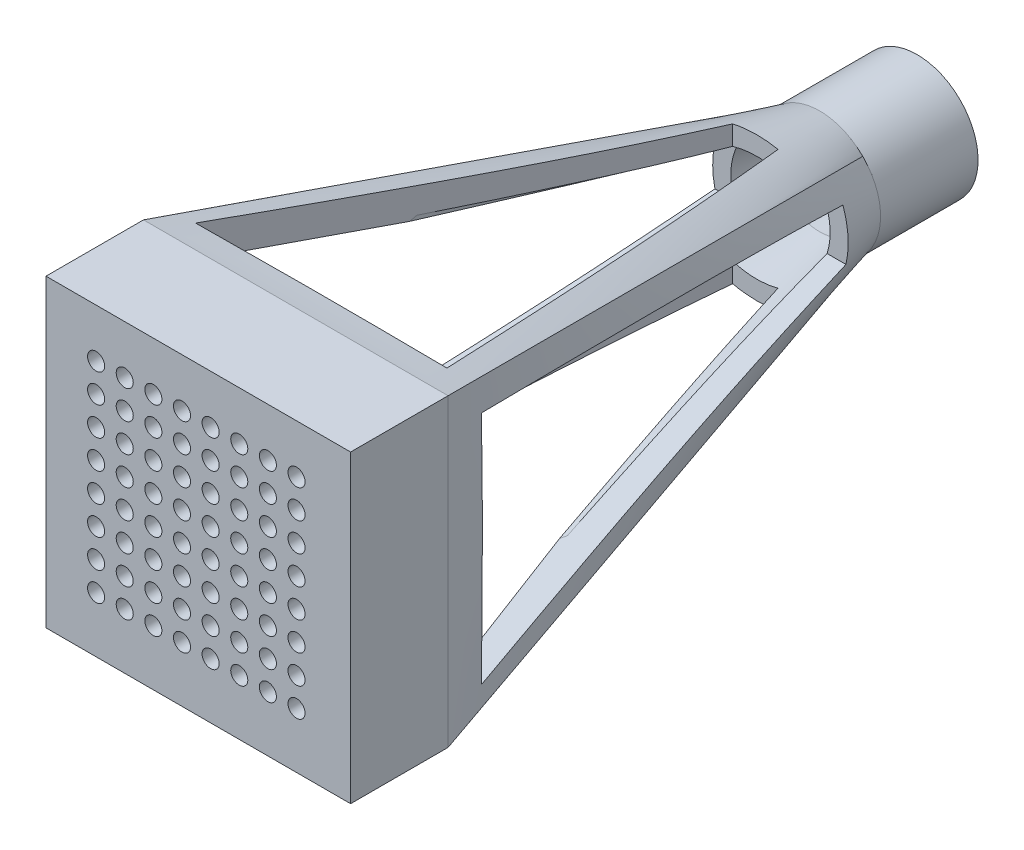
from build123d import *

# Parameters (mm, degrees)
SKETCH4_W           = 25
SKETCH4_H           = 25
BOSS_EXTRUDE1_DEPTH = 8
SKETCH5_R           = 0.7
CUT_EXTRUDE1_DEPTH  = 8
SKETCH6_R           = 5
SKETCH6_R_2         = 3.6
BOSS_EXTRUDE2_DEPTH = 8
CUT_EXTRUDE2_DEPTH  = 58
CUT_EXTRUDE3_DEPTH  = 58
CUT_EXTRUDE4_DEPTH  = 58
CUT_EXTRUDE5_DEPTH  = 58


with BuildPart() as part:
    # Loft1: read off the stored shape, not the designer's step
    # Loft1: loft between two sections, ruled curve by curve
    loft1_from = [
        Edge.make_bspline([(-12.5, 12.5, 43), (-10.416666667, 12.5, 43), (-8.333333333, 12.5, 43), (-5.208333333, 12.5, 43), (-4.166666667, 12.5, 43), (-2.083333333, 12.5, 43), (-1.041666667, 12.5, 43), (1.041666667, 12.5, 43), (2.083333333, 12.5, 43), (4.166666667, 12.5, 43), (5.208333333, 12.5, 43), (8.333333333, 12.5, 43), (10.416666667, 12.5, 43), (12.5, 12.5, 43)], [0, 0, 0, 0, 0.25, 0.25, 0.375, 0.375, 0.5, 0.5, 0.625, 0.625, 0.75, 0.75, 1, 1, 1, 1], 3),
        Edge.make_bspline([(12.5, 12.5, 43), (12.5, 10.416666667, 43), (12.5, 8.333333333, 43), (12.5, 5.208333333, 43), (12.5, 4.166666667, 43), (12.5, 2.083333333, 43), (12.5, 1.041666667, 43), (12.5, -1.041666667, 43), (12.5, -2.083333333, 43), (12.5, -4.166666667, 43), (12.5, -5.208333333, 43), (12.5, -8.333333333, 43), (12.5, -10.416666667, 43), (12.5, -12.5, 43)], [0, 0, 0, 0, 0.25, 0.25, 0.375, 0.375, 0.5, 0.5, 0.625, 0.625, 0.75, 0.75, 1, 1, 1, 1], 3),
        Edge.make_bspline([(-12.5, -12.5, 43), (-12.5, -10.416666667, 43), (-12.5, -8.333333333, 43), (-12.5, -5.208333333, 43), (-12.5, -4.166666667, 43), (-12.5, -2.083333333, 43), (-12.5, -1.041666667, 43), (-12.5, 1.041666667, 43), (-12.5, 2.083333333, 43), (-12.5, 4.166666667, 43), (-12.5, 5.208333333, 43), (-12.5, 8.333333333, 43), (-12.5, 10.416666667, 43), (-12.5, 12.5, 43)], [0, 0, 0, 0, 0.25, 0.25, 0.375, 0.375, 0.5, 0.5, 0.625, 0.625, 0.75, 0.75, 1, 1, 1, 1], 3),
        Edge.make_bspline([(12.5, -12.5, 43), (10.416666667, -12.5, 43), (8.333333333, -12.5, 43), (5.208333333, -12.5, 43), (4.166666667, -12.5, 43), (2.083333333, -12.5, 43), (1.041666667, -12.5, 43), (-1.041666667, -12.5, 43), (-2.083333333, -12.5, 43), (-4.166666667, -12.5, 43), (-5.208333333, -12.5, 43), (-8.333333333, -12.5, 43), (-10.416666667, -12.5, 43), (-12.5, -12.5, 43)], [0, 0, 0, 0, 0.25, 0.25, 0.375, 0.375, 0.5, 0.5, 0.625, 0.625, 0.75, 0.75, 1, 1, 1, 1], 3),
    ]
    loft1_to = [
        Edge.make_bspline([(-3.535533906, 3.535533906, 0), (-3.118867239, 3.952200573, 0), (-2.593397212, 4.325792981, 0), (-1.6821315, 4.720167594, 0), (-1.358816515, 4.823924825, 0), (-0.690278229, 4.963884467, 0), (-0.345177969, 5, 0), (0.345177969, 5, 0), (0.690278229, 4.963884467, 0), (1.358816515, 4.823924825, 0), (1.6821315, 4.720167594, 0), (2.593397212, 4.325792981, 0), (3.118867239, 3.952200573, 0), (3.535533906, 3.535533906, 0)], [0, 0, 0, 0, 0.25, 0.25, 0.375, 0.375, 0.5, 0.5, 0.625, 0.625, 0.75, 0.75, 1, 1, 1, 1], 3),
        Edge.make_bspline([(3.535533906, 3.535533906, 0), (3.952200573, 3.118867239, 0), (4.325792981, 2.593397212, 0), (4.720167594, 1.6821315, 0), (4.823924825, 1.358816515, 0), (4.963884467, 0.690278229, 0), (5, 0.345177969, 0), (5, -0.345177969, 0), (4.963884467, -0.690278229, 0), (4.823924825, -1.358816515, 0), (4.720167594, -1.6821315, 0), (4.325792981, -2.593397212, 0), (3.952200573, -3.118867239, 0), (3.535533906, -3.535533906, 0)], [0, 0, 0, 0, 0.25, 0.25, 0.375, 0.375, 0.5, 0.5, 0.625, 0.625, 0.75, 0.75, 1, 1, 1, 1], 3),
        Edge.make_bspline([(-3.535533906, -3.535533906, 0), (-3.952200573, -3.118867239, 0), (-4.325792981, -2.593397212, 0), (-4.720167594, -1.6821315, 0), (-4.823924825, -1.358816515, 0), (-4.963884467, -0.690278229, 0), (-5, -0.345177969, 0), (-5, 0.345177969, 0), (-4.963884467, 0.690278229, 0), (-4.823924825, 1.358816515, 0), (-4.720167594, 1.6821315, 0), (-4.325792981, 2.593397212, 0), (-3.952200573, 3.118867239, 0), (-3.535533906, 3.535533906, 0)], [0, 0, 0, 0, 0.25, 0.25, 0.375, 0.375, 0.5, 0.5, 0.625, 0.625, 0.75, 0.75, 1, 1, 1, 1], 3),
        Edge.make_bspline([(3.535533906, -3.535533906, 0), (3.118867239, -3.952200573, 0), (2.593397212, -4.325792981, 0), (1.6821315, -4.720167594, 0), (1.358816515, -4.823924825, 0), (0.690278229, -4.963884467, 0), (0.345177969, -5, 0), (-0.345177969, -5, 0), (-0.690278229, -4.963884467, 0), (-1.358816515, -4.823924825, 0), (-1.6821315, -4.720167594, 0), (-2.593397212, -4.325792981, 0), (-3.118867239, -3.952200573, 0), (-3.535533906, -3.535533906, 0)], [0, 0, 0, 0, 0.25, 0.25, 0.375, 0.375, 0.5, 0.5, 0.625, 0.625, 0.75, 0.75, 1, 1, 1, 1], 3),
    ]
    loft1 = Solid(Shell([*[Face.make_surface_from_curves(loft1_from[k], loft1_to[k]) for k in range(4)], Face(Wire(loft1_from)), Face(Wire(loft1_to))]))
    add(loft1)

    # Cut-Loft1: read off the stored shape, not the designer's step
    # Cut-Loft1: loft between two sections, ruled curve by curve
    cut_loft1_from = [
        Edge.make_bspline([(-2.545584412, -2.545584412, 0), (-2.245584412, -2.845584412, 0), (-1.867245993, -3.114570946, 0), (-0.992430909, -3.493170575, 0), (-0.497056275, -3.6, 0), (0.497056275, -3.6, 0), (0.992430909, -3.493170575, 0), (1.867245993, -3.114570946, 0), (2.245584412, -2.845584412, 0), (2.545584412, -2.545584412, 0)], [0, 0, 0, 0, 0.25, 0.25, 0.5, 0.5, 0.75, 0.75, 1, 1, 1, 1], 3),
        Edge.make_bspline([(2.545584412, -2.545584412, 0), (2.845584412, -2.245584412, 0), (3.114570946, -1.867245993, 0), (3.493170575, -0.992430909, 0), (3.6, -0.497056275, 0), (3.6, 0.497056275, 0), (3.493170575, 0.992430909, 0), (3.114570946, 1.867245993, 0), (2.845584412, 2.245584412, 0), (2.545584412, 2.545584412, 0)], [0, 0, 0, 0, 0.25, 0.25, 0.5, 0.5, 0.75, 0.75, 1, 1, 1, 1], 3),
        Edge.make_bspline([(-2.545584412, 2.545584412, 0), (-2.845584412, 2.245584412, 0), (-3.114570946, 1.867245993, 0), (-3.493170575, 0.992430909, 0), (-3.6, 0.497056275, 0), (-3.6, -0.497056275, 0), (-3.493170575, -0.992430909, 0), (-3.114570946, -1.867245993, 0), (-2.845584412, -2.245584412, 0), (-2.545584412, -2.545584412, 0)], [0, 0, 0, 0, 0.25, 0.25, 0.5, 0.5, 0.75, 0.75, 1, 1, 1, 1], 3),
        Edge.make_bspline([(2.545584412, 2.545584412, 0), (2.245584412, 2.845584412, 0), (1.867245993, 3.114570946, 0), (0.992430909, 3.493170575, 0), (0.497056275, 3.6, 0), (-0.497056275, 3.6, 0), (-0.992430909, 3.493170575, 0), (-1.867245993, 3.114570946, 0), (-2.245584412, 2.845584412, 0), (-2.545584412, 2.545584412, 0)], [0, 0, 0, 0, 0.25, 0.25, 0.5, 0.5, 0.75, 0.75, 1, 1, 1, 1], 3),
    ]
    cut_loft1_to = [
        Edge.make_bspline([(-10, -10, 43), (-8.333333333, -10, 43), (-6.666666667, -10, 43), (-3.333333333, -10, 43), (-1.666666667, -10, 43), (1.666666667, -10, 43), (3.333333333, -10, 43), (6.666666667, -10, 43), (8.333333333, -10, 43), (10, -10, 43)], [0, 0, 0, 0, 0.25, 0.25, 0.5, 0.5, 0.75, 0.75, 1, 1, 1, 1], 3),
        Edge.make_bspline([(10, -10, 43), (10, -8.333333333, 43), (10, -6.666666667, 43), (10, -3.333333333, 43), (10, -1.666666667, 43), (10, 1.666666667, 43), (10, 3.333333333, 43), (10, 6.666666667, 43), (10, 8.333333333, 43), (10, 10, 43)], [0, 0, 0, 0, 0.25, 0.25, 0.5, 0.5, 0.75, 0.75, 1, 1, 1, 1], 3),
        Edge.make_bspline([(-10, 10, 43), (-10, 8.333333333, 43), (-10, 6.666666667, 43), (-10, 3.333333333, 43), (-10, 1.666666667, 43), (-10, -1.666666667, 43), (-10, -3.333333333, 43), (-10, -6.666666667, 43), (-10, -8.333333333, 43), (-10, -10, 43)], [0, 0, 0, 0, 0.25, 0.25, 0.5, 0.5, 0.75, 0.75, 1, 1, 1, 1], 3),
        Edge.make_bspline([(10, 10, 43), (8.333333333, 10, 43), (6.666666667, 10, 43), (3.333333333, 10, 43), (1.666666667, 10, 43), (-1.666666667, 10, 43), (-3.333333333, 10, 43), (-6.666666667, 10, 43), (-8.333333333, 10, 43), (-10, 10, 43)], [0, 0, 0, 0, 0.25, 0.25, 0.5, 0.5, 0.75, 0.75, 1, 1, 1, 1], 3),
    ]
    cut_loft1 = Solid(Shell([*[Face.make_surface_from_curves(cut_loft1_from[k], cut_loft1_to[k]) for k in range(4)], Face(Wire(cut_loft1_from)), Face(Wire(cut_loft1_to))]))
    add(cut_loft1, mode=Mode.SUBTRACT)

    # Sketch4 → Boss-Extrude1 (add)
    with BuildSketch(Plane.XY.offset(43)):
        Rectangle(SKETCH4_W, SKETCH4_H)
    extrude(amount=BOSS_EXTRUDE1_DEPTH)

    # Sketch5 → Cut-Extrude1 (cut)
    with BuildSketch(Plane.XY.offset(43)):
        with Locations((-8.388056057, 8.509622087)):
            Circle(SKETCH5_R)
        with Locations((-6.038056057, 8.509622087)):
            Circle(SKETCH5_R)
        with Locations((-3.688056057, 8.509622087)):
            Circle(SKETCH5_R)
        with Locations((-1.338056057, 8.509622087)):
            Circle(SKETCH5_R)
        with Locations((1.011943943, 8.509622087)):
            Circle(SKETCH5_R)
        with Locations((3.361943943, 8.509622087)):
            Circle(SKETCH5_R)
        with Locations((5.711943943, 8.509622087)):
            Circle(SKETCH5_R)
        with Locations((8.061943943, 8.509622087)):
            Circle(SKETCH5_R)
        with Locations((-6.038056057, 6.159622087)):
            Circle(SKETCH5_R)
        with Locations((-3.688056057, 6.159622087)):
            Circle(SKETCH5_R)
        with Locations((-1.338056057, 6.159622087)):
            Circle(SKETCH5_R)
        with Locations((1.011943943, 6.159622087)):
            Circle(SKETCH5_R)
        with Locations((3.361943943, 6.159622087)):
            Circle(SKETCH5_R)
        with Locations((5.711943943, 6.159622087)):
            Circle(SKETCH5_R)
        with Locations((8.061943943, 6.159622087)):
            Circle(SKETCH5_R)
        with Locations((-6.038056057, 3.809622087)):
            Circle(SKETCH5_R)
        with Locations((-3.688056057, 3.809622087)):
            Circle(SKETCH5_R)
        with Locations((-1.338056057, 3.809622087)):
            Circle(SKETCH5_R)
        with Locations((1.011943943, 3.809622087)):
            Circle(SKETCH5_R)
        with Locations((3.361943943, 3.809622087)):
            Circle(SKETCH5_R)
        with Locations((5.711943943, 3.809622087)):
            Circle(SKETCH5_R)
        with Locations((8.061943943, 3.809622087)):
            Circle(SKETCH5_R)
        with Locations((-6.038056057, 1.459622087)):
            Circle(SKETCH5_R)
        with Locations((-3.688056057, 1.459622087)):
            Circle(SKETCH5_R)
        with Locations((-1.338056057, 1.459622087)):
            Circle(SKETCH5_R)
        with Locations((1.011943943, 1.459622087)):
            Circle(SKETCH5_R)
        with Locations((3.361943943, 1.459622087)):
            Circle(SKETCH5_R)
        with Locations((5.711943943, 1.459622087)):
            Circle(SKETCH5_R)
        with Locations((8.061943943, 1.459622087)):
            Circle(SKETCH5_R)
        with Locations((-6.038056057, -0.890377913)):
            Circle(SKETCH5_R)
        with Locations((-3.688056057, -0.890377913)):
            Circle(SKETCH5_R)
        with Locations((-1.338056057, -0.890377913)):
            Circle(SKETCH5_R)
        with Locations((1.011943943, -0.890377913)):
            Circle(SKETCH5_R)
        with Locations((3.361943943, -0.890377913)):
            Circle(SKETCH5_R)
        with Locations((5.711943943, -0.890377913)):
            Circle(SKETCH5_R)
        with Locations((8.061943943, -0.890377913)):
            Circle(SKETCH5_R)
        with Locations((-6.038056057, -3.240377913)):
            Circle(SKETCH5_R)
        with Locations((-3.688056057, -3.240377913)):
            Circle(SKETCH5_R)
        with Locations((-1.338056057, -3.240377913)):
            Circle(SKETCH5_R)
        with Locations((1.011943943, -3.240377913)):
            Circle(SKETCH5_R)
        with Locations((3.361943943, -3.240377913)):
            Circle(SKETCH5_R)
        with Locations((5.711943943, -3.240377913)):
            Circle(SKETCH5_R)
        with Locations((8.061943943, -3.240377913)):
            Circle(SKETCH5_R)
        with Locations((-6.038056057, -5.590377913)):
            Circle(SKETCH5_R)
        with Locations((-3.688056057, -5.590377913)):
            Circle(SKETCH5_R)
        with Locations((-1.338056057, -5.590377913)):
            Circle(SKETCH5_R)
        with Locations((1.011943943, -5.590377913)):
            Circle(SKETCH5_R)
        with Locations((3.361943943, -5.590377913)):
            Circle(SKETCH5_R)
        with Locations((5.711943943, -5.590377913)):
            Circle(SKETCH5_R)
        with Locations((8.061943943, -5.590377913)):
            Circle(SKETCH5_R)
        with Locations((-6.038056057, -7.940377913)):
            Circle(SKETCH5_R)
        with Locations((-3.688056057, -7.940377913)):
            Circle(SKETCH5_R)
        with Locations((-1.338056057, -7.940377913)):
            Circle(SKETCH5_R)
        with Locations((1.011943943, -7.940377913)):
            Circle(SKETCH5_R)
        with Locations((3.361943943, -7.940377913)):
            Circle(SKETCH5_R)
        with Locations((5.711943943, -7.940377913)):
            Circle(SKETCH5_R)
        with Locations((8.061943943, -7.940377913)):
            Circle(SKETCH5_R)
        with Locations((-8.388056057, 6.159622087)):
            Circle(SKETCH5_R)
        with Locations((-8.388056057, 3.809622087)):
            Circle(SKETCH5_R)
        with Locations((-8.388056057, 1.459622087)):
            Circle(SKETCH5_R)
        with Locations((-8.388056057, -0.890377913)):
            Circle(SKETCH5_R)
        with Locations((-8.388056057, -3.240377913)):
            Circle(SKETCH5_R)
        with Locations((-8.388056057, -5.590377913)):
            Circle(SKETCH5_R)
        with Locations((-8.388056057, -7.940377913)):
            Circle(SKETCH5_R)
    extrude(amount=CUT_EXTRUDE1_DEPTH, mode=Mode.SUBTRACT)

    # Sketch6 → Boss-Extrude2 (add)
    with BuildSketch(Plane(origin=(0, 0, 0), x_dir=(-1, 0, 0), z_dir=(0, 0, -1))):
        with Locations(Location((0, 0, 0), (0, 0, 135))):
            Circle(SKETCH6_R)
        with Locations(Location((0, 0, 0), (0, 0, 225))):
            Circle(SKETCH6_R_2, mode=Mode.SUBTRACT)
    extrude(amount=BOSS_EXTRUDE2_DEPTH)

    # Sketch7 → Cut-Extrude2 (cut)
    with BuildSketch(Plane(origin=(0, 0, 0), x_dir=(1, 0, 0), z_dir=(0, 1, 0))):
        Polygon((-1.965717978, -5.179711055), (1.757861177, -5.179711055), (10.010117682, -40.604031661), (-10.620523581, -40.604031661), align=None)
    extrude(amount=-CUT_EXTRUDE2_DEPTH, mode=Mode.SUBTRACT)

    # Sketch7<3> → Cut-Extrude3 (cut)
    with BuildSketch(Plane(origin=(0, 0, 0), x_dir=(1, 0, 0), z_dir=(0, 1, 0))):
        Polygon((-1.965717978, -5.179711055), (1.757861177, -5.179711055), (10.010117682, -40.604031661), (-10.620523581, -40.604031661), align=None)
    extrude(amount=CUT_EXTRUDE3_DEPTH, mode=Mode.SUBTRACT)

    # Sketch8 → Cut-Extrude4 (cut)
    with BuildSketch(Plane(origin=(0, 0, 0), x_dir=(0, 0, -1), z_dir=(1, 0, 0))):
        Polygon((-3.220235662, 2.475386447), (-3.220235662, -1.618521908), (-39.589374996, -10.091960129), (-39.589374996, 9.23509559), align=None)
    extrude(amount=-CUT_EXTRUDE4_DEPTH, mode=Mode.SUBTRACT)

    # Sketch8<3> → Cut-Extrude5 (cut)
    with BuildSketch(Plane(origin=(0, 0, 0), x_dir=(0, 0, -1), z_dir=(1, 0, 0))):
        Polygon((-3.220235662, 2.475386447), (-3.220235662, -1.618521908), (-39.589374996, -10.091960129), (-39.589374996, 9.23509559), align=None)
    extrude(amount=CUT_EXTRUDE5_DEPTH, mode=Mode.SUBTRACT)


solid = part.part
